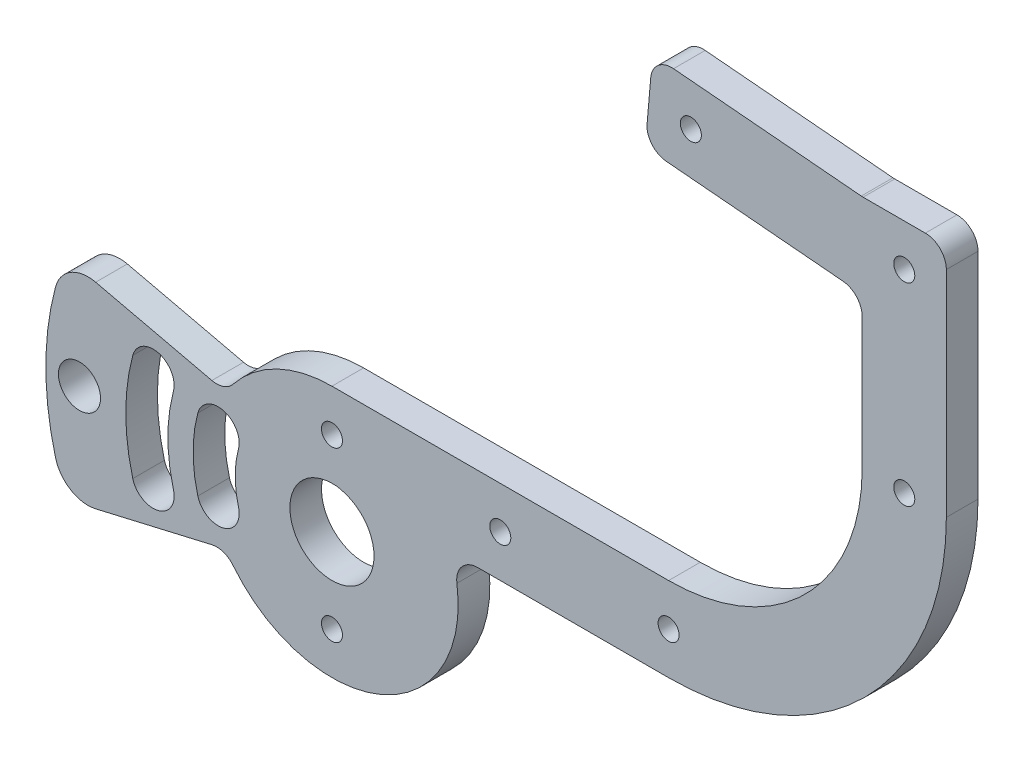
from build123d import *

# Parameters (mm, degrees)
SKETCH1_R           = 3.175
BOSS_EXTRUDE1_DEPTH = 4.7752
FILLET1_R           = 3.175
SKETCH2_R           = 1.5875
CUT_EXTRUDE2_DEPTH  = 12.6492


with BuildPart() as part:
    # Sketch1 → Boss-Extrude1 (new body)
    with BuildSketch(Plane.XY):
        with BuildLine():
            ThreePointArc((-41.708677179, -11.175806368), (-39.414754754, -14.217464212), (-35.65126732, -14.809008693))
            Line((-35.65126732, -14.809008693), (-16.055699309, -10.252659153))
            ThreePointArc((-16.055699309, -10.252659153), (8.35578547, -17.119677251), (17.960512242, 6.35))
            Line((17.960512242, 6.35), (50.8, 6.35))
            ThreePointArc((50.8, 6.35), (80.4348452, 18.6251548), (92.71, 48.26))
            Line((92.71, 48.26), (92.71, 83.82))
            Line((92.71, 83.82), (80.01, 83.82))
            Line((80.01, 83.82), (48.380818336, 86.587194832))
            Line((48.380818336, 86.587194832), (47.273940403, 73.935522166))
            Line((47.273940403, 73.935522166), (80.01, 71.071488063))
            Line((80.01, 71.071488063), (80.01, 48.26))
            ThreePointArc((80.01, 48.26), (71.454589078, 27.605410922), (50.8, 19.05))
            Line((50.8, 19.05), (0, 19.05))
            ThreePointArc((0, 19.05), (-9.153942952, 16.706520536), (-16.055699309, 10.252659153))
            Line((-16.055699309, 10.252659153), (-35.65126732, 14.809008693))
            ThreePointArc((-35.65126732, 14.809008693), (-39.414754754, 14.217464212), (-41.708677179, 11.175806368))
            ThreePointArc((-41.708677179, 11.175806368), (-43.18, 0), (-41.708677179, -11.175806368))
        make_face()
        with BuildLine():
            ThreePointArc((-23.921153088, -6.409653652), (-26.166217118, -10.298218619), (-30.054782085, -8.053154588))
            ThreePointArc((-30.054782085, -8.053154588), (-31.115, 0), (-30.054782085, 8.053154588))
            ThreePointArc((-30.054782085, 8.053154588), (-26.166217118, 10.298218619), (-23.921153088, 6.409653652))
            ThreePointArc((-23.921153088, 6.409653652), (-24.765, 0), (-23.921153088, -6.409653652))
        make_face(mode=Mode.SUBTRACT)
        with BuildLine():
            ThreePointArc((-20.24097569, -5.42355309), (-20.955, 0), (-20.24097569, 5.42355309))
            ThreePointArc((-20.24097569, 5.42355309), (-16.352410723, 7.66861712), (-14.107346693, 3.780052154))
            ThreePointArc((-14.107346693, 3.780052154), (-14.605, 0), (-14.107346693, -3.780052154))
            ThreePointArc((-14.107346693, -3.780052154), (-16.352410723, -7.66861712), (-20.24097569, -5.42355309))
        make_face(mode=Mode.SUBTRACT)
        with Locations((-38.1, 0)):
            Circle(SKETCH1_R, mode=Mode.SUBTRACT)
        with BuildLine():
            ThreePointArc((1.438133327, 6.185003843), (-0.723783669, -6.308616108), (0, 6.35))
            Line((0, 6.35), (0.728531617, 6.35))
            Line((0.728531617, 6.35), (1.438133327, 6.185003843))
        make_face(mode=Mode.SUBTRACT)
    extrude(amount=BOSS_EXTRUDE1_DEPTH)

    # Fillet1
    # the kernel refuses this fillet: 3.175 mm, written as the material it adds along each edge
    with BuildSketch(Plane(origin=(-16.055699309, 10.252659153, 0), x_dir=(0.5808999309278821, 0.8139749813403246, 0), z_dir=(0, 0, 1))) as fillet1_piece_1:
        with BuildLine():
            CenterArc((2.126250916, 3.170784423), FILLET1_R, 202.42407708, 64.623066475)
            Line((-0.808674052, 1.959652545), (0, 0))
            ThreePointArc((0, 0), (0.981346577, 0.025293461), (1.962693154, 0))
        make_face()
    extrude(amount=4.7752)
    with BuildSketch(Plane(origin=(80.01, 71.071488063, 0), x_dir=(-0.9961946980917454, 0.08715574274765892, 0), z_dir=(0, 0, 1))) as fillet1_piece_2:
        with BuildLine():
            CenterArc((FILLET1_R * 0.916331174017, FILLET1_R), FILLET1_R, 185, 85)
            Line((-FILLET1_R * 0.0798635240743, FILLET1_R * 0.912844257252), (0, 0))
            Line((0, 0), (FILLET1_R * 0.916331174017, 0))
        make_face()
    extrude(amount=4.7752)
    with BuildSketch(Plane(origin=(80.01, 83.82, 0), x_dir=(1, 0, 0), z_dir=(0, 0, 1))) as fillet1_piece_3:
        with BuildLine():
            CenterArc((FILLET1_R * 0.0436609429085, FILLET1_R), FILLET1_R, 265, 5)
            Line((-FILLET1_R * 0.0434947998391, FILLET1_R * 0.00380530190826), (0, 0))
            Line((0, 0), (FILLET1_R * 0.0436609429085, 0))
        make_face()
    extrude(amount=4.7752)
    with BuildSketch(Plane(origin=(17.960512242, 6.35, 0), x_dir=(0.23924892683917381, -0.9709582642968253, 0), z_dir=(0, 0, 1))) as fillet1_piece_4:
        with BuildLine():
            CenterArc((4.048528681, 3.159689746), FILLET1_R, 166.157784332, 98.213210702)
            Line((0.965736192, 3.919305089), (0, 0))
            ThreePointArc((0, 0), (1.868551699, 0.091861522), (3.737103398, 0))
        make_face()
    extrude(amount=4.7752)
    with BuildSketch(Plane(origin=(-16.055699309, -10.252659153, 0), x_dir=(-0.9740163531879217, -0.22647768923781808, 0), z_dir=(0, 0, 1))) as fillet1_piece_5:
        with BuildLine():
            CenterArc((2.1199509, 3.175), FILLET1_R, 205.376933525, 64.623066475)
            ThreePointArc((-0.748686692, 1.814285714), (-0.350962429, 0.916791272), (0, 0))
            Line((0, 0), (2.1199509, 0))
        make_face()
    extrude(amount=4.7752)
    # the kernel refuses this fillet: 3.175 mm, written as the material it takes off along each edge
    with BuildSketch(Plane(origin=(47.273940403, 73.935522166, -7.9375), x_dir=(0.0871557427476583, 0.9961946980917454, 0), z_dir=(0, 0, 1)), Plane(origin=(48.380818336, 86.587194832, -7.9375), x_dir=(0.9961946980917455, -0.08715574274765811, 0), z_dir=(0, 0, 1)), Plane(origin=(92.71, 83.82, -7.9375), x_dir=(0, -1, 0), z_dir=(0, 0, 1))) as fillet1_2_piece_1:
        with BuildLine():
            CenterArc((FILLET1_R, -FILLET1_R), FILLET1_R, 90, 90)
            Line((0, -FILLET1_R), (0, 0))
            Line((0, 0), (FILLET1_R, 0))
        make_face()
    extrude(amount=20.6502, mode=Mode.SUBTRACT)

    # Sketch2 → Cut-Extrude2 (cut)
    with BuildSketch(Plane.XY.offset(4.7752)):
        with Locations((0, 12.7)):
            Circle(SKETCH2_R)
        with Locations((0, -12.7)):
            Circle(SKETCH2_R)
        with Locations((25.4, 12.7)):
            Circle(SKETCH2_R)
        with Locations((54.153215702, 79.707919533)):
            Circle(SKETCH2_R)
        with Locations((50.8, 12.7)):
            Circle(SKETCH2_R)
        with Locations((86.36, 77.47)):
            Circle(SKETCH2_R)
        with Locations((86.36, 48.26)):
            Circle(SKETCH2_R)
    extrude(amount=-CUT_EXTRUDE2_DEPTH, mode=Mode.SUBTRACT)


solid = part.part
